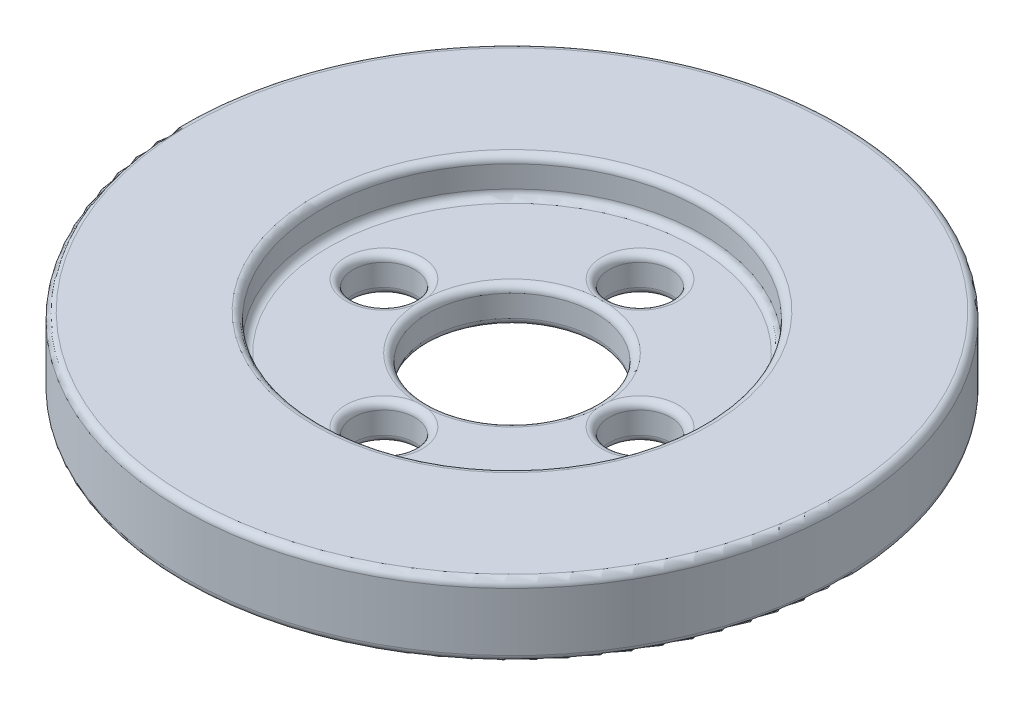
from build123d import *

# Parameters (mm, degrees)
SKETCH1_R           = 18.15
SKETCH1_R_2         = 10.5
BOSS_EXTRUDE1_DEPTH = 2
BOSS_EXTRUDE2_START = -2
SKETCH1_3_R         = 18.15
SKETCH1_3_R_2       = 10.5
BOSS_EXTRUDE2_DEPTH = 2
SKETCH2_R           = 4.6
SKETCH2_R_2         = 1.7
CUT_EXTRUDE1_DEPTH  = 2
FILLET1_R           = 0.4


with BuildPart() as part:
    # Sketch1 → Boss-Extrude1 (new body)
    with BuildSketch(Plane(origin=(0, 0, 0), x_dir=(1, 0, 0), z_dir=(0, 1, 0))):
        with Locations(Location((0, 0, 0), (0, 0, 270))):
            Circle(SKETCH1_R)
        with Locations(Location((0, 0, 0), (0, 0, 270))):
            Circle(SKETCH1_R_2, mode=Mode.SUBTRACT)
    extrude(amount=BOSS_EXTRUDE1_DEPTH)

    # Sketch1<3> → Boss-Extrude2 (add)
    # profile 1 of 2: a face of its own
    with BuildSketch(Plane(origin=(0, 0, 0), x_dir=(1, 0, 0), z_dir=(0, 1, 0)).offset(BOSS_EXTRUDE2_START)):
        with Locations(Location((0, 0, 0), (0, 0, 270))):
            Circle(SKETCH1_3_R)
        with Locations(Location((0, 0, 0), (0, 0, 270))):
            Circle(SKETCH1_3_R_2, mode=Mode.SUBTRACT)
    # profile 2 of 2: a face of its own
    with BuildSketch(Plane(origin=(0, 0, 0), x_dir=(1, 0, 0), z_dir=(0, 1, 0)).offset(BOSS_EXTRUDE2_START)):
        with Locations(Location((0, 0, 0), (0, 0, 270))):
            Circle(SKETCH1_3_R_2)
    extrude(amount=BOSS_EXTRUDE2_DEPTH)

    # Sketch2 → Cut-Extrude1 (cut)
    with BuildSketch(Plane(origin=(0, 0, 0), x_dir=(1, 0, 0), z_dir=(0, 1, 0))):
        with Locations(Location((0, 0, 0), (0, 0, 270))):
            Circle(SKETCH2_R)
        with Locations(Location((0, 7.05, 0), (0, 0, 270))):
            Circle(SKETCH2_R_2)
        with Locations(Location((7.05, 0, 0), (0, 0, 270))):
            Circle(SKETCH2_R_2)
        with Locations(Location((0, -7.05, 0), (0, 0, 270))):
            Circle(SKETCH2_R_2)
        with Locations(Location((-7.05, 0, 0), (0, 0, 270))):
            Circle(SKETCH2_R_2)
    extrude(amount=-CUT_EXTRUDE1_DEPTH, mode=Mode.SUBTRACT)

    # Fillet1
    # the kernel refuses this fillet: 0.4 mm, written as the material it adds along each edge
    with BuildSketch(Plane(origin=(0, 0, 0), x_dir=(0, 0, 1), z_dir=(-1, 0, 0))) as fillet1_piece_1:
        with BuildLine():
            CenterArc((10.1001, 0.3999), FILLET1_R, 270, 90)
            Line((10.1001, -0.0001), (10.1001, -0.0081))
            ThreePointArc((10.1001, -0.0081), (10.30005, -0.008), (10.5, -0.008))
            Line((10.5, -0.008), (10.508, 0))
            ThreePointArc((10.508, 0), (10.508, 0.19995), (10.5081, 0.3999))
            Line((10.5081, 0.3999), (10.5001, 0.3999))
        make_face()
    revolve(axis=Axis((0, 0, 0), (0, 1, 0)))
    # the kernel refuses this fillet: 0.4 mm, written as the material it takes off along each edge
    with BuildSketch(Plane(origin=(0, -2, -7.05), x_dir=(0, 0, 1), z_dir=(-1, 0, 0))) as fillet1_2_piece_1:
        with BuildLine():
            CenterArc((2.0999, 0.3999), FILLET1_R, 180, 90)
            Line((1.6999, 0.3999), (1.6919, 0.3999))
            ThreePointArc((1.6919, 0.3999), (1.692, 0.19995), (1.692, 0))
            Line((1.692, 0), (1.7, -0.008))
            ThreePointArc((1.7, -0.008), (1.89995, -0.008), (2.0999, -0.0081))
            Line((2.0999, -0.0081), (2.0999, -0.0001))
        make_face()
    revolve(axis=Axis((0, -2, -7.05), (0, 1, 0)), mode=Mode.SUBTRACT)
    with BuildSketch(Plane(origin=(0, 0, -7.05), x_dir=(0, 0, 1), z_dir=(-1, 0, 0))) as fillet1_2_piece_2:
        with BuildLine():
            CenterArc((2.0999, -0.3999), FILLET1_R, 90, 90)
            Line((2.0999, 0.0001), (2.0999, 0.0081))
            ThreePointArc((2.0999, 0.0081), (1.89995, 0.008), (1.7, 0.008))
            Line((1.7, 0.008), (1.692, 0))
            ThreePointArc((1.692, 0), (1.692, -0.19995), (1.6919, -0.3999))
            Line((1.6919, -0.3999), (1.6999, -0.3999))
        make_face()
    revolve(axis=Axis((0, 0, -7.05), (0, 1, 0)), mode=Mode.SUBTRACT)
    with BuildSketch(Plane(origin=(7.05, -2, 0), x_dir=(0, 0, 1), z_dir=(-1, 0, 0))) as fillet1_2_piece_3:
        with BuildLine():
            CenterArc((2.0999, 0.3999), FILLET1_R, 180, 90)
            Line((1.6999, 0.3999), (1.6919, 0.3999))
            ThreePointArc((1.6919, 0.3999), (1.692, 0.19995), (1.692, 0))
            Line((1.692, 0), (1.7, -0.008))
            ThreePointArc((1.7, -0.008), (1.89995, -0.008), (2.0999, -0.0081))
            Line((2.0999, -0.0081), (2.0999, -0.0001))
        make_face()
    revolve(axis=Axis((7.05, -2, 0), (0, 1, 0)), mode=Mode.SUBTRACT)
    with BuildSketch(Plane(origin=(7.05, 0, 0), x_dir=(0, 0, 1), z_dir=(-1, 0, 0))) as fillet1_2_piece_4:
        with BuildLine():
            CenterArc((2.0999, -0.3999), FILLET1_R, 90, 90)
            Line((2.0999, 0.0001), (2.0999, 0.0081))
            ThreePointArc((2.0999, 0.0081), (1.89995, 0.008), (1.7, 0.008))
            Line((1.7, 0.008), (1.692, 0))
            ThreePointArc((1.692, 0), (1.692, -0.19995), (1.6919, -0.3999))
            Line((1.6919, -0.3999), (1.6999, -0.3999))
        make_face()
    revolve(axis=Axis((7.05, 0, 0), (0, 1, 0)), mode=Mode.SUBTRACT)
    with BuildSketch(Plane(origin=(0, -2, 7.05), x_dir=(0, 0, 1), z_dir=(-1, 0, 0))) as fillet1_2_piece_5:
        with BuildLine():
            CenterArc((2.0999, 0.3999), FILLET1_R, 180, 90)
            Line((1.6999, 0.3999), (1.6919, 0.3999))
            ThreePointArc((1.6919, 0.3999), (1.692, 0.19995), (1.692, 0))
            Line((1.692, 0), (1.7, -0.008))
            ThreePointArc((1.7, -0.008), (1.89995, -0.008), (2.0999, -0.0081))
            Line((2.0999, -0.0081), (2.0999, -0.0001))
        make_face()
    revolve(axis=Axis((0, -2, 7.05), (0, 1, 0)), mode=Mode.SUBTRACT)
    with BuildSketch(Plane(origin=(0, 0, 7.05), x_dir=(0, 0, 1), z_dir=(-1, 0, 0))) as fillet1_2_piece_6:
        with BuildLine():
            CenterArc((2.0999, -0.3999), FILLET1_R, 90, 90)
            Line((2.0999, 0.0001), (2.0999, 0.0081))
            ThreePointArc((2.0999, 0.0081), (1.89995, 0.008), (1.7, 0.008))
            Line((1.7, 0.008), (1.692, 0))
            ThreePointArc((1.692, 0), (1.692, -0.19995), (1.6919, -0.3999))
            Line((1.6919, -0.3999), (1.6999, -0.3999))
        make_face()
    revolve(axis=Axis((0, 0, 7.05), (0, 1, 0)), mode=Mode.SUBTRACT)
    with BuildSketch(Plane(origin=(-7.05, -2, 0), x_dir=(0, 0, 1), z_dir=(-1, 0, 0))) as fillet1_2_piece_7:
        with BuildLine():
            CenterArc((2.0999, 0.3999), FILLET1_R, 180, 90)
            Line((1.6999, 0.3999), (1.6919, 0.3999))
            ThreePointArc((1.6919, 0.3999), (1.692, 0.19995), (1.692, 0))
            Line((1.692, 0), (1.7, -0.008))
            ThreePointArc((1.7, -0.008), (1.89995, -0.008), (2.0999, -0.0081))
            Line((2.0999, -0.0081), (2.0999, -0.0001))
        make_face()
    revolve(axis=Axis((-7.05, -2, 0), (0, 1, 0)), mode=Mode.SUBTRACT)
    with BuildSketch(Plane(origin=(-7.05, 0, 0), x_dir=(0, 0, 1), z_dir=(-1, 0, 0))) as fillet1_2_piece_8:
        with BuildLine():
            CenterArc((2.0999, -0.3999), FILLET1_R, 90, 90)
            Line((2.0999, 0.0001), (2.0999, 0.0081))
            ThreePointArc((2.0999, 0.0081), (1.89995, 0.008), (1.7, 0.008))
            Line((1.7, 0.008), (1.692, 0))
            ThreePointArc((1.692, 0), (1.692, -0.19995), (1.6919, -0.3999))
            Line((1.6919, -0.3999), (1.6999, -0.3999))
        make_face()
    revolve(axis=Axis((-7.05, 0, 0), (0, 1, 0)), mode=Mode.SUBTRACT)
    with BuildSketch(Plane(origin=(0, -2, 0), x_dir=(0, 0, 1), z_dir=(-1, 0, 0))) as fillet1_2_piece_9:
        with BuildLine():
            CenterArc((4.9999, 0.3999), FILLET1_R, 180, 90)
            Line((4.5999, 0.3999), (4.5919, 0.3999))
            ThreePointArc((4.5919, 0.3999), (4.592, 0.19995), (4.592, 0))
            Line((4.592, 0), (4.6, -0.008))
            ThreePointArc((4.6, -0.008), (4.79995, -0.008), (4.9999, -0.0081))
            Line((4.9999, -0.0081), (4.9999, -0.0001))
        make_face()
    revolve(axis=Axis((0, -2, 0), (0, 1, 0)), mode=Mode.SUBTRACT)
    with BuildSketch(Plane(origin=(0, 0, 0), x_dir=(0, 0, 1), z_dir=(-1, 0, 0))) as fillet1_2_piece_10:
        with BuildLine():
            CenterArc((4.9999, -0.3999), FILLET1_R, 90, 90)
            Line((4.9999, 0.0001), (4.9999, 0.0081))
            ThreePointArc((4.9999, 0.0081), (4.79995, 0.008), (4.6, 0.008))
            Line((4.6, 0.008), (4.592, 0))
            ThreePointArc((4.592, 0), (4.592, -0.19995), (4.5919, -0.3999))
            Line((4.5919, -0.3999), (4.5999, -0.3999))
        make_face()
    revolve(axis=Axis((0, 0, 0), (0, 1, 0)), mode=Mode.SUBTRACT)
    with BuildSketch(Plane(origin=(0, 2, 0), x_dir=(0, 0, 1), z_dir=(-1, 0, 0))) as fillet1_2_piece_11:
        with BuildLine():
            CenterArc((17.7501, -0.3999), FILLET1_R, 0, 90)
            Line((17.7501, 0.0001), (17.7501, 0.0081))
            ThreePointArc((17.7501, 0.0081), (17.95005, 0.008), (18.15, 0.008))
            Line((18.15, 0.008), (18.158, 0))
            ThreePointArc((18.158, 0), (18.158, -0.19995), (18.1581, -0.3999))
            Line((18.1581, -0.3999), (18.1501, -0.3999))
        make_face()
    revolve(axis=Axis((0, 2, 0), (0, 1, 0)), mode=Mode.SUBTRACT)
    with BuildSketch(Plane(origin=(0, 2, 0), x_dir=(0, 0, 1), z_dir=(-1, 0, 0))) as fillet1_2_piece_12:
        with BuildLine():
            CenterArc((10.8999, -0.3999), FILLET1_R, 90, 90)
            Line((10.4999, -0.3999), (10.4919, -0.3999))
            ThreePointArc((10.4919, -0.3999), (10.492, -0.19995), (10.492, 0))
            Line((10.492, 0), (10.5, 0.008))
            ThreePointArc((10.5, 0.008), (10.69995, 0.008), (10.8999, 0.0081))
            Line((10.8999, 0.0081), (10.8999, 0.0001))
        make_face()
    revolve(axis=Axis((0, 2, 0), (0, 1, 0)), mode=Mode.SUBTRACT)
    with BuildSketch(Plane(origin=(0, -2, 0), x_dir=(0, 0, 1), z_dir=(-1, 0, 0))) as fillet1_2_piece_13:
        with BuildLine():
            CenterArc((17.7501, 0.3999), FILLET1_R, 270, 90)
            Line((17.7501, -0.0001), (17.7501, -0.0081))
            ThreePointArc((17.7501, -0.0081), (17.95005, -0.008), (18.15, -0.008))
            Line((18.15, -0.008), (18.158, 0))
            ThreePointArc((18.158, 0), (18.158, 0.19995), (18.1581, 0.3999))
            Line((18.1581, 0.3999), (18.1501, 0.3999))
        make_face()
    revolve(axis=Axis((0, -2, 0), (0, 1, 0)), mode=Mode.SUBTRACT)


solid = part.part
